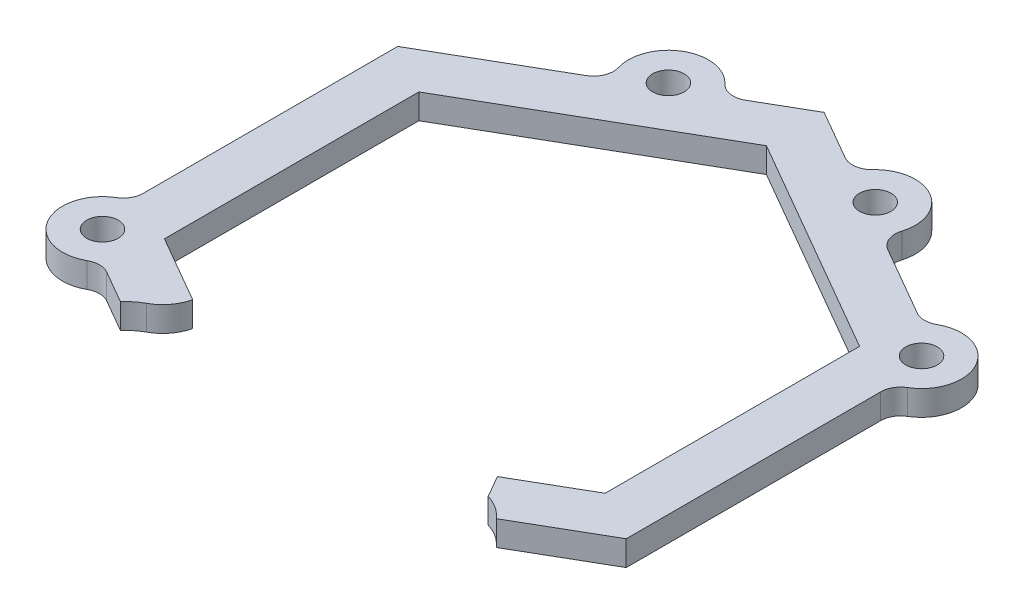
from build123d import *

# Parameters (mm, degrees)
SKETCH1_R            = 50.8
SKETCH1_R_2          = 48.8
SKETCH1_R_3          = 1.905
BOSS_EXTRUDE1_DEPTH  = 3.175
SKETCH3_R            = 50.8
SKETCH3_R_2          = 48.8
BOSS_EXTRUDE3_DEPTH  = 17.78
CUT_EXTRUDE1_DEPTH   = 75.009515604
FILLET2_R            = 6.35
SKETCH5_R            = 1.905
SKETCH5_W            = 16.479
SKETCH5_H            = 6
BOSS_EXTRUDE4_DEPTH  = 1
CUT_EXTRUDE2_DEPTH   = 75.835767181
BOSS_EXTRUDE5_DEPTH  = 17.78
SKETCH10_R           = 1.5
CUT_EXTRUDE4_DEPTH   = 75.009515742
BOSS_EXTRUDE7_START  = 17.78
SKETCH11_R           = 4.04
SKETCH11_R_2         = 1.5
BOSS_EXTRUDE7_DEPTH  = 17.78
BOSS_EXTRUDE8_START  = 31.75
BOSS_EXTRUDE8_DEPTH  = 31.75
FILLET4_R            = 3.175
BOSS_EXTRUDE9_DEPTH  = 15.24
CUT_EXTRUDE5_REACH   = 128.859
CIRPATTERN1_COUNT    = 4
BOSS_EXTRUDE12_DEPTH = 16.51
FILLET8_START        = -18
FILLET8_DEPTH        = 18
FILLET8_START_2      = -16.51
FILLET8_2_DEPTH      = 16.51
BOSS_EXTRUDE13_DEPTH = 1.5
FILLET9_R            = 5.08
BOSS_EXTRUDE14_START = -18.01
BOSS_EXTRUDE14_DEPTH = 18.01
SKETCH21_R           = 1.5
SKETCH21_R_2         = 1.905
BOSS_EXTRUDE15_DEPTH = 3.175
SKETCH22_R           = 73.302422264
CUT_EXTRUDE6_DEPTH   = 38.965
SKETCH24_R           = 2
CUT_EXTRUDE7_DEPTH   = 3.175
BOSS_EXTRUDE16_DEPTH = 3.175
FILLET10_R           = 2.54


with BuildPart() as part:
    # Sketch1 → Boss-Extrude1 (new body)
    # profile 1 of 2: a face of its own
    with BuildSketch(Plane(origin=(0, 0, 0), x_dir=(1, 0, 0), z_dir=(0, 1, 0))):
        with Locations(Location((0, 0, 0), (0, 0, 270))):
            Circle(SKETCH1_R)
        Circle(SKETCH1_R_2, mode=Mode.SUBTRACT)
    # profile 2 of 2: a face of its own
    with BuildSketch(Plane(origin=(0, 0, 0), x_dir=(1, 0, 0), z_dir=(0, 1, 0))):
        Circle(SKETCH1_R_2)
        with Locations(Location((-13.1445, 33.02, 0), (0, 0, 270))):
            Circle(SKETCH1_R_3, mode=Mode.SUBTRACT)
        with Locations(Location((13.1445, 33.02, 0), (0, 0, 270))):
            Circle(SKETCH1_R_3, mode=Mode.SUBTRACT)
    extrude(amount=BOSS_EXTRUDE1_DEPTH)

    # Sketch3 → Boss-Extrude3 (add)
    with BuildSketch(Plane(origin=(0, 3.175, 0), x_dir=(1, 0, 0), z_dir=(0, 1, 0))):
        with Locations(Location((0, 0, 0), (0, 0, 270))):
            Circle(SKETCH3_R)
        with Locations(Location((0, 0, 0), (0, 0, 270))):
            Circle(SKETCH3_R_2, mode=Mode.SUBTRACT)
    extrude(amount=BOSS_EXTRUDE3_DEPTH)

    # Sketch4 → Cut-Extrude1 (cut, through all)
    with BuildSketch(Plane(origin=(0, 3.175, 0), x_dir=(1, 0, 0), z_dir=(0, 1, 0))):
        with BuildLine():
            Line((25.4, -38.01523905), (25.4, -20.834346642))
            add(Edge.make_bspline(
                [(-25.4, -20.834346642), (0, -32.254229315), (25.4, -20.834346642)],
                knots=[0, 0, 0, 1, 1, 1], degree=2))
            Line((-25.4, -20.834346642), (-25.4, -38.01523905))
            ThreePointArc((-25.4, -38.01523905), (0, -45.72), (25.4, -38.01523905))
        make_face()
    extrude(amount=-CUT_EXTRUDE1_DEPTH, mode=Mode.SUBTRACT)

    # Fillet2
    fillet2_edges = [part.edges().sort_by_distance(p)[0] for p in [
        (25.4, 1.5875, 20.834346642),
        (-25.4, 1.5875, 20.834346642),
        (-25.4, 1.5875, 38.01523905),
        (25.4, 1.5875, 38.01523905),
    ]]
    fillet(fillet2_edges, radius=FILLET2_R)

    # Sketch5 → Boss-Extrude4 (add)
    # profile 1 of 8: a face of its own
    with BuildSketch(Plane(origin=(0, 3.175, 0), x_dir=(1, 0, 0), z_dir=(0, 1, 0))):
        with BuildLine():
            Line((13.1445, 37.925), (-13.1445, 37.925))
            ThreePointArc((-13.1445, 37.925), (-9.676141238, 36.488358762), (-8.2395, 33.02))
            Line((-8.2395, 33.02), (-8.2395, 28.115))
            Line((-8.2395, 28.115), (8.2395, 28.115))
            Line((8.2395, 28.115), (8.2395, 33.02))
            ThreePointArc((8.2395, 33.02), (9.676141238, 36.488358762), (13.1445, 37.925))
        make_face()
    # profile 2 of 8: a face of its own
    with BuildSketch(Plane(origin=(0, 3.175, 0), x_dir=(1, 0, 0), z_dir=(0, 1, 0))):
        with BuildLine():
            ThreePointArc((-8.2395, 33.02), (-9.676141238, 36.488358762), (-13.1445, 37.925))
            ThreePointArc((-13.1445, 37.925), (-16.612858762, 36.488358762), (-18.0495, 33.02))
            ThreePointArc((-18.0495, 33.02), (-16.612858762, 29.551641238), (-13.1445, 28.115))
            ThreePointArc((-13.1445, 28.115), (-9.676141238, 29.551641238), (-8.2395, 33.02))
        make_face()
        with Locations(Location((-13.1445, 33.02, 0), (0, 0, 270))):
            Circle(SKETCH5_R, mode=Mode.SUBTRACT)
    # profile 3 of 8: a face of its own
    with BuildSketch(Plane(origin=(0, 3.175, 0), x_dir=(1, 0, 0), z_dir=(0, 1, 0))):
        with BuildLine():
            ThreePointArc((18.0495, 33.02), (16.612858762, 36.488358762), (13.1445, 37.925))
            ThreePointArc((13.1445, 37.925), (9.676141238, 36.488358762), (8.2395, 33.02))
            ThreePointArc((8.2395, 33.02), (9.676141238, 29.551641238), (13.1445, 28.115))
            ThreePointArc((13.1445, 28.115), (16.612858762, 29.551641238), (18.0495, 33.02))
        make_face()
        with Locations(Location((13.1445, 33.02, 0), (0, 0, 270))):
            Circle(SKETCH5_R, mode=Mode.SUBTRACT)
    # profile 4 of 8: a face of its own
    with BuildSketch(Plane(origin=(0, 3.175, 0), x_dir=(1, 0, 0), z_dir=(0, 1, 0))):
        with BuildLine():
            Line((-8.2395, 28.115), (-8.2395, 33.02))
            ThreePointArc((-8.2395, 33.02), (-9.676141238, 29.551641238), (-13.1445, 28.115))
            Line((-13.1445, 28.115), (-8.2395, 28.115))
        make_face()
    # profile 5 of 8: a face of its own
    with BuildSketch(Plane(origin=(0, 3.175, 0), x_dir=(1, 0, 0), z_dir=(0, 1, 0))):
        with BuildLine():
            ThreePointArc((-13.1445, 28.115), (-16.612858762, 29.551641238), (-18.0495, 33.02))
            Line((-18.0495, 33.02), (-18.0495, -23.729829016))
            add(Edge.make_bspline(
                [(-17.200482213, -23.925830908), (-17.339134534, -23.883616376), (-17.479112922, -23.845147844), (-17.620279441, -23.81048615), (-17.762494237, -23.779683986), (-17.905615595, -23.752786017), (-18.049499996, -23.729828993)],
                knots=[0, 0, 0, 0, 0, 0, 0, 0.074218898, 0.074218898, 0.074218898, 0.074218898, 0.074218898, 0.074218898, 0.074218898], degree=6))
            add(Edge.make_bspline(
                [(-17.200482213, -23.925830908), (-12.719991107, -25.289975642), (-8.2395, -25.943438167)],
                knots=[0.16140783, 0.16140783, 0.16140783, 0.337805118, 0.337805118, 0.337805118], degree=2))
            Line((-8.2395, -25.943438167), (-8.2395, -2.461719083))
            Line((-8.2395, -2.461719083), (-8.2395, 3.538280917))
            Line((-8.2395, 3.538280917), (-8.2395, 28.115))
            Line((-8.2395, 28.115), (-13.1445, 28.115))
        make_face()
    # profile 6 of 8: a face of its own
    with BuildSketch(Plane(origin=(0, 3.175, 0), x_dir=(1, 0, 0), z_dir=(0, 1, 0))):
        with BuildLine():
            Line((18.0495, -23.729829016), (18.0495, 33.02))
            ThreePointArc((18.0495, 33.02), (16.612858762, 29.551641238), (13.1445, 28.115))
            Line((13.1445, 28.115), (8.2395, 28.115))
            Line((8.2395, 28.115), (8.2395, 3.538280917))
            Line((8.2395, 3.538280917), (8.2395, -2.461719083))
            Line((8.2395, -2.461719083), (8.2395, -25.943438167))
            add(Edge.make_bspline(
                [(8.2395, -25.943438167), (12.719991107, -25.289975642), (17.200482213, -23.925830908)],
                knots=[0.662194882, 0.662194882, 0.662194882, 0.83859217, 0.83859217, 0.83859217], degree=2))
            add(Edge.make_bspline(
                [(18.049499996, -23.729828993), (17.905615595, -23.752786017), (17.762494237, -23.779683986), (17.620279441, -23.81048615), (17.479112922, -23.845147844), (17.339134534, -23.883616376), (17.200482213, -23.925830908)],
                knots=[0.925781102, 0.925781102, 0.925781102, 0.925781102, 0.925781102, 0.925781102, 0.925781102, 1, 1, 1, 1, 1, 1, 1], degree=6))
        make_face()
    # profile 7 of 8: a face of its own
    with BuildSketch(Plane(origin=(0, 3.175, 0), x_dir=(1, 0, 0), z_dir=(0, 1, 0))):
        with BuildLine():
            ThreePointArc((13.1445, 28.115), (9.676141238, 29.551641238), (8.2395, 33.02))
            Line((8.2395, 33.02), (8.2395, 28.115))
            Line((8.2395, 28.115), (13.1445, 28.115))
        make_face()
    # profile 8 of 8: a face of its own
    with BuildSketch(Plane(origin=(0, 3.175, 0), x_dir=(1, 0, 0), z_dir=(0, 1, 0))):
        with Locations((0, 0.538280917)):
            Rectangle(SKETCH5_W, SKETCH5_H)
    extrude(amount=BOSS_EXTRUDE4_DEPTH)

    # Sketch6 → Cut-Extrude2 (cut, through all)
    with BuildSketch(Plane(origin=(0, 20.955, 0), x_dir=(1, 0, 0), z_dir=(0, 1, 0))):
        with BuildLine():
            Line((42.262039705, 24.4), (39.594681461, 22.86))
            ThreePointArc((39.594681461, 22.86), (44.162128778, 11.833206742), (45.72, 0))
            Line((45.72, 0), (48.8, 0))
            ThreePointArc((48.8, 0), (47.137180323, 12.630369401), (42.262039705, 24.4))
        make_face()
        with BuildLine():
            ThreePointArc((45.72, 0), (44.162128778, -11.833206742), (39.594681461, -22.86))
            Line((39.594681461, -22.86), (42.262039705, -24.4))
            ThreePointArc((42.262039705, -24.4), (47.137180323, -12.630369401), (48.8, 0))
            Line((48.8, 0), (45.72, 0))
        make_face()
        with BuildLine():
            ThreePointArc((48.8, 0), (47.137180323, -12.630369401), (42.262039705, -24.4))
            Line((42.262039705, -24.4), (43.994090512, -25.4))
            ThreePointArc((43.994090512, -25.4), (49.069031975, -13.148007491), (50.8, 0))
            Line((50.8, 0), (48.8, 0))
        make_face()
        with BuildLine():
            Line((43.994090512, 25.4), (42.262039705, 24.4))
            ThreePointArc((42.262039705, 24.4), (47.137180323, 12.630369401), (48.8, 0))
            Line((48.8, 0), (50.8, 0))
            ThreePointArc((50.8, 0), (49.069031975, 13.148007491), (43.994090512, 25.4))
        make_face()
    extrude(amount=-CUT_EXTRUDE2_DEPTH, mode=Mode.SUBTRACT)

    # Sketch7 → Boss-Extrude5 (add)
    with BuildSketch(Plane(origin=(0, 3.175, 0), x_dir=(1, 0, 0), z_dir=(0, 1, 0))):
        with BuildLine():
            Line((42.262039705, -24.4), (39.594681461, -22.86))
            ThreePointArc((39.594681461, -22.86), (45.72, 0), (39.594681461, 22.86))
            Line((39.594681461, 22.86), (42.262039705, 24.4))
            ThreePointArc((42.262039705, 24.4), (41.753056776, 25.261081723), (41.226531944, 26.111550392))
            Line((41.226531944, 26.111550392), (36.822993007, 23.569166002))
            ThreePointArc((36.822993007, 23.569166002), (43.72, 0), (36.822993007, -23.569166002))
            Line((36.822993007, -23.569166002), (41.226531944, -26.111550392))
            ThreePointArc((41.226531944, -26.111550392), (41.753056776, -25.261081723), (42.262039705, -24.4))
        make_face()
    extrude(amount=BOSS_EXTRUDE5_DEPTH)

    # Sketch10 → Cut-Extrude4 (cut, through all)
    with BuildSketch(Plane(origin=(0, 3.175, 0), x_dir=(1, 0, 0), z_dir=(0, 1, 0))):
        with Locations(Location((-32.995567884, -19.05, 0), (0, 0, 270))):
            Circle(SKETCH10_R)
        with Locations(Location((32.995567884, 19.05, 0), (0, 0, 270))):
            Circle(SKETCH10_R)
    extrude(amount=-CUT_EXTRUDE4_DEPTH, mode=Mode.SUBTRACT)

    # Sketch11 → Boss-Extrude7 (add)
    # profile 1 of 3: a face of its own
    with BuildSketch(Plane(origin=(0, 3.175, 0), x_dir=(1, 0, 0), z_dir=(0, 1, 0)).offset(BOSS_EXTRUDE7_START)):
        with BuildLine():
            Line((37.125332322, 23.09), (32.995567884, 23.09))
            ThreePointArc((32.995567884, 23.09), (35.85227928, 21.906711396), (37.035567884, 19.05))
            ThreePointArc((37.035567884, 19.05), (35.85227928, 16.193288604), (32.995567884, 15.01))
            Line((32.995567884, 15.01), (41.062614383, 15.01))
            ThreePointArc((41.062614383, 15.01), (39.302167275, 19.151450272), (37.125332322, 23.09))
        make_face()
    # profile 2 of 3: a face of its own
    with BuildSketch(Plane(origin=(0, 3.175, 0), x_dir=(1, 0, 0), z_dir=(0, 1, 0)).offset(BOSS_EXTRUDE7_START)):
        with Locations((32.995567884, 19.05)):
            Circle(SKETCH11_R)
        with Locations(Location((32.995567884, 19.05, 0), (0, 0, 270))):
            Circle(SKETCH11_R_2, mode=Mode.SUBTRACT)
    # profile 3 of 3: a face of its own
    with BuildSketch(Plane(origin=(0, 3.175, 0), x_dir=(1, 0, 0), z_dir=(0, 1, 0)).offset(BOSS_EXTRUDE7_START)):
        with Locations(Location((-32.995567884, -19.05, 0), (0, 0, 270))):
            Circle(SKETCH11_R)
        with Locations(Location((-32.995567884, -19.05, 0), (0, 0, 270))):
            Circle(SKETCH11_R_2, mode=Mode.SUBTRACT)
    extrude(amount=-BOSS_EXTRUDE7_DEPTH)

    # Sketch12 → Boss-Extrude8 (add)
    with BuildSketch(Plane.XZ.offset(BOSS_EXTRUDE8_START)):
        with BuildLine():
            ThreePointArc((28.584071469, 41.995128982), (29.185832393, 29.185832393), (41.995128982, 28.584071469))
            ThreePointArc((41.995128982, 28.584071469), (35.921024484, 35.921024484), (28.584071469, 41.995128982))
        make_face()
        with BuildLine():
            ThreePointArc((28.584071469, -41.995128982), (35.921024484, -35.921024484), (41.995128982, -28.584071469))
            ThreePointArc((41.995128982, -28.584071469), (29.185832393, -29.185832393), (28.584071469, -41.995128982))
        make_face()
        with BuildLine():
            ThreePointArc((-41.995128982, 28.584071469), (-29.185832393, 29.185832393), (-28.584071469, 41.995128982))
            ThreePointArc((-28.584071469, 41.995128982), (-35.921024484, 35.921024484), (-41.995128982, 28.584071469))
        make_face()
        with BuildLine():
            ThreePointArc((-41.995128982, -28.584071469), (-35.921024484, -35.921024484), (-28.584071469, -41.995128982))
            ThreePointArc((-28.584071469, -41.995128982), (-29.185832393, -29.185832393), (-41.995128982, -28.584071469))
        make_face()
    extrude(amount=-BOSS_EXTRUDE8_DEPTH)

    # Fillet4
    fillet4_edges = [part.edges().sort_by_distance(p)[0] for p in [
        (41.995128982, -15.875, 28.584071469),
        (28.584071469, -15.875, 41.995128982),
        (28.584071469, -15.875, -41.995128982),
        (41.995128982, -15.875, -28.584071469),
        (-28.584071469, -15.875, 41.995128982),
        (-41.995128982, -15.875, 28.584071469),
        (-41.995128982, -15.875, -28.584071469),
        (-28.584071469, -15.875, -41.995128982),
    ]]
    fillet(fillet4_edges, radius=FILLET4_R)

    # Sketch13 → Boss-Extrude9 (add)
    with BuildSketch(Plane.XZ.offset(31.75)):
        Polygon((35.022998872, 35.022998872), (30.532870812, 39.513126933), (26.940768363, 35.921024484), (35.921024484, 26.940768363), (39.513126933, 30.532870812), align=None)
        Polygon((26.940763662, -35.921029185), (35.921019783, -26.940773064), (39.513122232, -30.532875513), (35.022994171, -35.023003573), (30.532866111, -39.513131634), align=None)
        Polygon((-35.921033886, -26.940768363), (-26.940777765, -35.921024484), (-30.532880214, -39.513126933), (-35.023008274, -35.022998872), (-39.513136335, -30.532870812), align=None)
        Polygon((-26.940773064, 35.921029185), (-35.921029185, 26.940773064), (-39.513131634, 30.532875513), (-35.023003573, 35.023003573), (-30.532875513, 39.513131634), align=None)
    extrude(amount=BOSS_EXTRUDE9_DEPTH)

    # Sketch15 → Cut-Extrude5 (cut, up to next)
    with BuildSketch(Plane(origin=(-35.023003573, 0, 35.023003573), x_dir=(0.7071067811865472, 0, 0.7071067811865479), z_dir=(-0.7071067811865479, 0, 0.7071067811865472)), mode=Mode.PRIVATE) as cut_extrude5_sk1:
        with BuildLine():
            ThreePointArc((-1.280368799, -37.833557441), (-1.536442559, -40.650368799), (1.280368799, -40.906442559))
            Line((1.280368799, -40.906442559), (-1.280368799, -37.833557441))
        make_face()
    cut_extrude5_tool1 = extrude(cut_extrude5_sk1.sketch, amount=-CUT_EXTRUDE5_REACH, mode=Mode.PRIVATE) & part.part
    # Sketch15 → Cut-Extrude5 (cut, up to next)
    with BuildSketch(Plane(origin=(-35.023003573, 0, 35.023003573), x_dir=(0.7071067811865472, 0, 0.7071067811865479), z_dir=(-0.7071067811865479, 0, 0.7071067811865472)), mode=Mode.PRIVATE) as cut_extrude5_sk2:
        with BuildLine():
            Line((-1.280368799, -37.833557441), (1.280368799, -40.906442559))
            ThreePointArc((1.280368799, -40.906442559), (1.811178842, -40.218310792), (2, -39.37))
            ThreePointArc((2, -39.37), (0.848310792, -37.558821158), (-1.280368799, -37.833557441))
        make_face()
    cut_extrude5_tool2 = extrude(cut_extrude5_sk2.sketch, amount=-CUT_EXTRUDE5_REACH, mode=Mode.PRIVATE) & part.part
    # Sketch15 → Cut-Extrude5 (cut, up to next)
    with BuildSketch(Plane(origin=(-35.023003573, 0, 35.023003573), x_dir=(0.7071067811865472, 0, 0.7071067811865479), z_dir=(-0.7071067811865479, 0, 0.7071067811865472)), mode=Mode.PRIVATE) as cut_extrude5_sk3:
        with BuildLine():
            ThreePointArc((-1.280368799, -37.833557441), (-1.536442559, -40.650368799), (1.280368799, -40.906442559))
            Line((1.280368799, -40.906442559), (-1.280368799, -37.833557441))
        make_face()
    cut_extrude5_tool3 = extrude(cut_extrude5_sk3.sketch, amount=-CUT_EXTRUDE5_REACH, mode=Mode.PRIVATE) & part.part
    # Sketch15 → Cut-Extrude5 (cut, up to next)
    with BuildSketch(Plane(origin=(-35.023003573, 0, 35.023003573), x_dir=(0.7071067811865472, 0, 0.7071067811865479), z_dir=(-0.7071067811865479, 0, 0.7071067811865472)), mode=Mode.PRIVATE) as cut_extrude5_sk4:
        with BuildLine():
            Line((-1.280368799, -37.833557441), (1.280368799, -40.906442559))
            ThreePointArc((1.280368799, -40.906442559), (1.811178842, -40.218310792), (2, -39.37))
            ThreePointArc((2, -39.37), (0.848310792, -37.558821158), (-1.280368799, -37.833557441))
        make_face()
    cut_extrude5_tool4 = extrude(cut_extrude5_sk4.sketch, amount=-CUT_EXTRUDE5_REACH, mode=Mode.PRIVATE) & part.part
    cut_extrude5_1 = cut_extrude5_tool1.solids().sort_by_distance((-35.484098, -39.913405, 34.561909))[0]
    add(cut_extrude5_1, mode=Mode.SUBTRACT)
    cut_extrude5_2 = cut_extrude5_tool2.solids().sort_by_distance((-34.561909, -38.826595, 35.484098))[0]
    add(cut_extrude5_2, mode=Mode.SUBTRACT)
    cut_extrude5_3 = cut_extrude5_tool3.solids().sort_by_distance((-35.484098, -39.913405, 34.561909))[0]
    add(cut_extrude5_3, mode=Mode.SUBTRACT)
    cut_extrude5_4 = cut_extrude5_tool4.solids().sort_by_distance((-34.561909, -38.826595, 35.484098))[0]
    add(cut_extrude5_4, mode=Mode.SUBTRACT)
    cut_extrude5 = cut_extrude5_1 + cut_extrude5_2 + cut_extrude5_3 + cut_extrude5_4  # Cut-Extrude5 as one shape, for the pattern or mirror that repeats it

    # CirPattern1: Cut-Extrude5; each copy of Cut-Extrude5 runs up to whatever stops it at its own place
    cirpattern1_before = part.part  # the part as the pattern finds it: every copy runs up to it
    cirpattern1_cut_extrude5_long1 = extrude(cut_extrude5_sk1.sketch, amount=-CUT_EXTRUDE5_REACH, mode=Mode.PRIVATE)
    cirpattern1_cut_extrude5_long2 = extrude(cut_extrude5_sk2.sketch, amount=-CUT_EXTRUDE5_REACH, mode=Mode.PRIVATE)
    cirpattern1_cut_extrude5_long3 = extrude(cut_extrude5_sk3.sketch, amount=-CUT_EXTRUDE5_REACH, mode=Mode.PRIVATE)
    cirpattern1_cut_extrude5_long4 = extrude(cut_extrude5_sk4.sketch, amount=-CUT_EXTRUDE5_REACH, mode=Mode.PRIVATE)
    cirpattern1_cut_extrude5_tool1_1 = cirpattern1_cut_extrude5_long1.rotate(Axis((0, 3.175, 0), (0, -1, 0)), 1 * 360 / CIRPATTERN1_COUNT) & cirpattern1_before
    add(cirpattern1_cut_extrude5_tool1_1.solids().sort_by_distance((-34.561909, -39.913405, -35.484098))[0], mode=Mode.SUBTRACT)
    cirpattern1_cut_extrude5_tool2_1 = cirpattern1_cut_extrude5_long2.rotate(Axis((0, 3.175, 0), (0, -1, 0)), 1 * 360 / CIRPATTERN1_COUNT) & cirpattern1_before
    add(cirpattern1_cut_extrude5_tool2_1.solids().sort_by_distance((-35.484098, -38.826595, -34.561909))[0], mode=Mode.SUBTRACT)
    cirpattern1_cut_extrude5_tool3_1 = cirpattern1_cut_extrude5_long3.rotate(Axis((0, 3.175, 0), (0, -1, 0)), 1 * 360 / CIRPATTERN1_COUNT) & cirpattern1_before
    add(cirpattern1_cut_extrude5_tool3_1.solids().sort_by_distance((-34.561909, -39.913405, -35.484098))[0], mode=Mode.SUBTRACT)
    cirpattern1_cut_extrude5_tool4_1 = cirpattern1_cut_extrude5_long4.rotate(Axis((0, 3.175, 0), (0, -1, 0)), 1 * 360 / CIRPATTERN1_COUNT) & cirpattern1_before
    add(cirpattern1_cut_extrude5_tool4_1.solids().sort_by_distance((-35.484098, -38.826595, -34.561909))[0], mode=Mode.SUBTRACT)
    cirpattern1_cut_extrude5_tool1_2 = cirpattern1_cut_extrude5_long1.rotate(Axis((0, 3.175, 0), (0, -1, 0)), 2 * 360 / CIRPATTERN1_COUNT) & cirpattern1_before
    add(cirpattern1_cut_extrude5_tool1_2.solids().sort_by_distance((35.484098, -39.913405, -34.561909))[0], mode=Mode.SUBTRACT)
    cirpattern1_cut_extrude5_tool2_2 = cirpattern1_cut_extrude5_long2.rotate(Axis((0, 3.175, 0), (0, -1, 0)), 2 * 360 / CIRPATTERN1_COUNT) & cirpattern1_before
    add(cirpattern1_cut_extrude5_tool2_2.solids().sort_by_distance((34.561909, -38.826595, -35.484098))[0], mode=Mode.SUBTRACT)
    cirpattern1_cut_extrude5_tool3_2 = cirpattern1_cut_extrude5_long3.rotate(Axis((0, 3.175, 0), (0, -1, 0)), 2 * 360 / CIRPATTERN1_COUNT) & cirpattern1_before
    add(cirpattern1_cut_extrude5_tool3_2.solids().sort_by_distance((35.484098, -39.913405, -34.561909))[0], mode=Mode.SUBTRACT)
    cirpattern1_cut_extrude5_tool4_2 = cirpattern1_cut_extrude5_long4.rotate(Axis((0, 3.175, 0), (0, -1, 0)), 2 * 360 / CIRPATTERN1_COUNT) & cirpattern1_before
    add(cirpattern1_cut_extrude5_tool4_2.solids().sort_by_distance((34.561909, -38.826595, -35.484098))[0], mode=Mode.SUBTRACT)
    cirpattern1_cut_extrude5_tool1_3 = cirpattern1_cut_extrude5_long1.rotate(Axis((0, 3.175, 0), (0, -1, 0)), 3 * 360 / CIRPATTERN1_COUNT) & cirpattern1_before
    add(cirpattern1_cut_extrude5_tool1_3.solids().sort_by_distance((34.561909, -39.913405, 35.484098))[0], mode=Mode.SUBTRACT)
    cirpattern1_cut_extrude5_tool2_3 = cirpattern1_cut_extrude5_long2.rotate(Axis((0, 3.175, 0), (0, -1, 0)), 3 * 360 / CIRPATTERN1_COUNT) & cirpattern1_before
    add(cirpattern1_cut_extrude5_tool2_3.solids().sort_by_distance((35.484098, -38.826595, 34.561909))[0], mode=Mode.SUBTRACT)
    cirpattern1_cut_extrude5_tool3_3 = cirpattern1_cut_extrude5_long3.rotate(Axis((0, 3.175, 0), (0, -1, 0)), 3 * 360 / CIRPATTERN1_COUNT) & cirpattern1_before
    add(cirpattern1_cut_extrude5_tool3_3.solids().sort_by_distance((34.561909, -39.913405, 35.484098))[0], mode=Mode.SUBTRACT)
    cirpattern1_cut_extrude5_tool4_3 = cirpattern1_cut_extrude5_long4.rotate(Axis((0, 3.175, 0), (0, -1, 0)), 3 * 360 / CIRPATTERN1_COUNT) & cirpattern1_before
    add(cirpattern1_cut_extrude5_tool4_3.solids().sort_by_distance((35.484098, -38.826595, 34.561909))[0], mode=Mode.SUBTRACT)

    # Sketch17 → Boss-Extrude12 (add)
    with BuildSketch(Plane.XZ):
        with BuildLine():
            add(Edge.make_bspline(
                [(-20.908385644, 23.92853792), (-21.252685586, 24.033914158), (-21.590074219, 24.162797085), (-21.918441414, 24.314613049), (-22.235799029, 24.488530911), (-22.540264994, 24.683499874), (-23.022979339, 25.041122982), (-23.209393805, 25.192784203), (-23.388812385, 25.35281665), (-23.560757013, 25.520801391), (-23.724786032, 25.69628198), (-23.880494201, 25.878764454)],
                knots=[0.318286262, 0.318286262, 0.318286262, 0.318286262, 0.318286262, 0.318286262, 0.318286262, 0.49999907, 0.49999907, 0.49999907, 0.49999907, 0.49999907, 0.620942534, 0.620942534, 0.620942534, 0.620942534, 0.620942534, 0.620942534, 0.620942534], degree=6))
            Line((-23.880494201, 25.878764454), (-33.118995485, 20.544913251))
            ThreePointArc((-33.118995485, 20.544913251), (-31.979482603, 20.153435862), (-31.495567884, 19.05))
            ThreePointArc((-31.495567884, 19.05), (-32.667330149, 17.586353872), (-34.351914536, 18.409434812))
            Line((-34.351914536, 18.409434812), (-34.351914536, -19.833087105))
            Line((-34.351914536, -19.833087105), (-14.226813668, -31.452319508))
            ThreePointArc((-14.226813668, -31.452319508), (-12.259283229, -31.333163829), (-11.2395, -33.02))
            ThreePointArc((-11.2395, -33.02), (-11.241048638, -33.096797874), (-11.245692035, -33.173470886))
            Line((-11.245692035, -33.173470886), (0, -39.666174209))
            Line((0, -39.666174209), (11.245692035, -33.173470886))
            ThreePointArc((11.245692035, -33.173470886), (12.192, -31.370221606), (14.226813668, -31.452319508))
            Line((14.226813668, -31.452319508), (33.118995485, -20.544913251))
            ThreePointArc((33.118995485, -20.544913251), (31.696529779, -18.3), (34.351914536, -18.409434812))
            Line((34.351914536, -18.409434812), (34.351914536, 19.833087105))
            Line((34.351914536, 19.833087105), (23.880494201, 25.878764454))
            add(Edge.make_bspline(
                [(23.880494201, 25.878764454), (23.724786032, 25.69628198), (23.560757013, 25.520801391), (23.388812385, 25.35281665), (23.209393805, 25.192784203), (23.022979339, 25.041122982), (22.540264994, 24.683499874), (22.235799029, 24.488530911), (21.918441414, 24.314613049), (21.590074219, 24.162797085), (21.252685586, 24.033914158), (20.908385644, 23.92853792)],
                knots=[0.379057466, 0.379057466, 0.379057466, 0.379057466, 0.379057466, 0.379057466, 0.379057466, 0.50000093, 0.50000093, 0.50000093, 0.50000093, 0.50000093, 0.681713738, 0.681713738, 0.681713738, 0.681713738, 0.681713738, 0.681713738, 0.681713738], degree=6))
            Line((20.908385644, 23.92853792), (31.176914536, 18))
            Line((31.176914536, 18), (31.176914536, -18))
            Line((31.176914536, -18), (0, -36))
            Line((0, -36), (-31.176914536, -18))
            Line((-31.176914536, -18), (-31.176914536, 18))
            Line((-31.176914536, 18), (-20.908385644, 23.92853792))
        make_face()
        with BuildLine():
            add(Edge.make_bspline(
                [(-17.200482213, 23.925830908), (-17.459469608, 23.846978773), (-17.723083673, 23.781196488), (-17.990425461, 23.728880551), (-18.260572685, 23.690328284), (-18.532581005, 23.665740503), (-19.00632449, 23.64748488), (-19.20765189, 23.647366474), (-19.40908444, 23.654911047), (-19.610239409, 23.670133105), (-19.810734433, 23.693019578), (-20.155249132, 23.745719833), (-20.29976023, 23.77194264), (-20.443574195, 23.802182667), (-20.58654585, 23.83641693), (-20.728531441, 23.874615043), (-20.875894192, 23.918684735), (-20.882397342, 23.920638634), (-20.888898077, 23.922600907), (-20.895396381, 23.924571547), (-20.901892242, 23.926550553), (-20.908385644, 23.92853792)],
                knots=[0, 0, 0, 0, 0, 0, 0, 0.138632797, 0.138632797, 0.138632797, 0.138632797, 0.138632797, 0.240657178, 0.240657178, 0.240657178, 0.240657178, 0.240657178, 0.314859209, 0.314859209, 0.314859209, 0.314859209, 0.314859209, 0.318286262, 0.318286262, 0.318286262, 0.318286262, 0.318286262, 0.318286262, 0.318286262], degree=6))
            Line((-20.908385644, 23.92853792), (-31.176914536, 18))
            Line((-31.176914536, 18), (-31.176914536, -18))
            Line((-31.176914536, -18), (0, -36))
            Line((0, -36), (31.176914536, -18))
            Line((31.176914536, -18), (31.176914536, 18))
            Line((31.176914536, 18), (20.908385644, 23.92853792))
            add(Edge.make_bspline(
                [(20.908385644, 23.92853792), (20.901892242, 23.926550553), (20.895396381, 23.924571547), (20.888898077, 23.922600907), (20.882397342, 23.920638634), (20.875894192, 23.918684735), (20.728531441, 23.874615043), (20.58654585, 23.83641693), (20.443574195, 23.802182667), (20.29976023, 23.77194264), (20.155249132, 23.745719833), (19.810734433, 23.693019578), (19.610239409, 23.670133105), (19.40908444, 23.654911047), (19.20765189, 23.647366474), (19.00632449, 23.64748488), (18.532581005, 23.665740503), (18.260572685, 23.690328284), (17.990425461, 23.728880551), (17.723083673, 23.781196488), (17.459469608, 23.846978773), (17.200482213, 23.925830908)],
                knots=[0.681713738, 0.681713738, 0.681713738, 0.681713738, 0.681713738, 0.681713738, 0.681713738, 0.685140791, 0.685140791, 0.685140791, 0.685140791, 0.685140791, 0.759342822, 0.759342822, 0.759342822, 0.759342822, 0.759342822, 0.861367203, 0.861367203, 0.861367203, 0.861367203, 0.861367203, 1, 1, 1, 1, 1, 1, 1], degree=6))
            add(Edge.make_bspline(
                [(17.200482211, 23.925830899), (17.144714317, 23.942810174), (17.08892802, 23.959728991), (17.03312338, 23.97658725), (16.977300457, 23.993384851), (16.92145931, 24.010121695), (14.159965962, 24.834525535), (11.411116029, 25.499660319), (8.627008592, 26.010516368), (5.817329363, 26.357677075), (2.993713037, 26.535534726), (0.170010835, 26.544032169)],
                knots=[0.167149631, 0.167149631, 0.167149631, 0.167149631, 0.167149631, 0.167149631, 0.167149631, 0.173816956, 0.173816956, 0.173816956, 0.173816956, 0.173816956, 0.496759352, 0.496759352, 0.496759352, 0.496759352, 0.496759352, 0.496759352, 0.496759352], degree=6))
            Line((0.170010835, 26.544032169), (-2.385708701, 22.319852499))
            add(Edge.make_bspline(
                [(1.620176348, 5.69433156), (1.509326153, 5.687881832), (-1.385391089, 5.53059626), (-5.611900633, 5.801343952), (-7.868551057, 6.347108354), (-8.955239032, 6.817181438), (-9.386496565, 7.143658554), (-9.437257428, 7.221736919), (-9.473831725, 7.283189394), (-9.560278482, 7.765593639), (-9.482042175, 8.88761919), (-8.935485792, 11.068929454), (-7.229003309, 14.855816655), (-4.379692923, 19.560468803), (-2.385708701, 22.319852499)],
                knots=[0.090051127, 0.090051127, 0.090051127, 0.09375, 0.1875, 0.28125, 0.34375, 0.40625, 0.46875, 0.53125, 0.59375, 0.65625, 0.71875, 0.8125, 0.90625, 1, 1, 1], degree=2))
            ThreePointArc((1.620176348, 5.69433156), (11.475358731, 8.358328841), (17.337085464, 0))
            ThreePointArc((17.337085464, 0), (12.304081548, -8.009724166), (2.903861345, -6.950163046))
            add(Edge.make_bspline(
                [(2.903861345, -6.950163046), (2.496424378, -6.977033131), (-1.281397682, -7.18582742), (-7.225551643, -6.849649329), (-11.650718957, -5.820633983), (-14.952826408, -4.460745526), (-17.953705537, -2.387123362), (-20.378422572, 0.505035294), (-21.860667408, 3.983957581), (-22.33638102, 7.612065838), (-22.020118931, 11.17069053), (-20.877728865, 15.552865246), (-18.404993389, 20.924969938), (-16.555707216, 23.971622428), (-16.445662414, 24.150603211)],
                knots=[0.08261428, 0.08261428, 0.08261428, 0.09375, 0.1875, 0.28125, 0.34375, 0.40625, 0.46875, 0.53125, 0.59375, 0.65625, 0.71875, 0.8125, 0.90625, 0.912069887, 0.912069887, 0.912069887], degree=2))
            add(Edge.make_bspline(
                [(-16.445662414, 24.150603211), (-16.515723238, 24.130208348), (-16.585755757, 24.109717462), (-16.655759831, 24.089130753), (-16.725735322, 24.068448419), (-16.79568209, 24.047670662), (-16.92145931, 24.010121695), (-16.977300457, 23.993384851), (-17.03312338, 23.97658725), (-17.08892802, 23.959728991), (-17.144714317, 23.942810174), (-17.200482211, 23.925830899)],
                knots=[0.817837696, 0.817837696, 0.817837696, 0.817837696, 0.817837696, 0.817837696, 0.817837696, 0.826183044, 0.826183044, 0.826183044, 0.826183044, 0.826183044, 0.832850369, 0.832850369, 0.832850369, 0.832850369, 0.832850369, 0.832850369, 0.832850369], degree=6))
        make_face()
    extrude(amount=BOSS_EXTRUDE12_DEPTH)

    # Fillet8: read off the stored shape, not the designer's step
    # Fillet8 outline → Fillet8 (cut)
    with BuildSketch(Plane(origin=(0, 0, 0), x_dir=(1, 0, 0), z_dir=(0, 1, 0)).offset(FILLET8_START)):
        with BuildLine():
            add(Edge.make_bspline(
                [(-17.200482213, -23.925830908), (-16.823072312, -24.04073834), (-16.445662411, -24.150603216)],
                knots=[0.16140783, 0.16140783, 0.16140783, 0.176266488, 0.176266488, 0.176266488], degree=2))
            add(Edge.make_bspline(
                [(-19.814278915, -17.857491149), (-19.729210788, -18.048061118), (-18.404993389, -20.924969938), (-16.555707215, -23.971622431), (-16.445662411, -24.150603216)],
                knots=[0.805838628, 0.805838628, 0.805838628, 0.8125, 0.90625, 0.912069887, 0.912069887, 0.912069887], degree=2))
            ThreePointArc((-19.814278915, -17.857491149), (-19.646031314, -21.570938879), (-22.051716439, -24.40478439))
            ThreePointArc((-22.051716439, -24.40478439), (-19.67389065, -23.681237871), (-17.200482213, -23.925830908))
        make_face()
        with BuildLine():
            ThreePointArc((3.27583035, -26.449313478), (0.61618061, -25.873433503), (-1.364645069, -24.007500998))
            Line((-1.364645069, -24.007500998), (0.170010834, -26.544032168))
            add(Edge.make_bspline(
                [(0.170010834, -26.544032168), (1.722920592, -26.53935894), (3.27583035, -26.449313478)],
                knots=[0.50334667, 0.50334667, 0.50334667, 0.564484849, 0.564484849, 0.564484849], degree=2))
        make_face()
    extrude(amount=FILLET8_DEPTH, mode=Mode.SUBTRACT)

    # Fillet8 2 outline → Fillet8 2 (add)
    with BuildSketch(Plane(origin=(0, 0, 0), x_dir=(1, 0, 0), z_dir=(0, 1, 0)).offset(FILLET8_START_2)):
        with BuildLine():
            ThreePointArc((-2.502754207, -22.15754776), (-2.387809079, -22.324172025), (-2.279593451, -22.495243373))
            Line((-2.279593451, -22.495243373), (-2.385708701, -22.319852499))
            add(Edge.make_bspline(
                [(-2.502754207, -22.15754776), (-2.444478741, -22.238523325), (-2.385708701, -22.319852499)],
                knots=[0.997236843, 0.997236843, 0.997236843, 1, 1, 1], degree=2))
        make_face()
    extrude(amount=FILLET8_2_DEPTH)

    # Sketch18 → Boss-Extrude13 (add)
    with BuildSketch(Plane.XZ.offset(16.51)):
        with BuildLine():
            Line((20.908385644, 23.92853792), (31.176914536, 18))
            Line((31.176914536, 18), (31.176914536, -18))
            Line((31.176914536, -18), (0, -36))
            Line((0, -36), (-31.176914536, -18))
            Line((-31.176914536, -18), (-31.176914536, 18))
            Line((-31.176914536, 18), (-21.15091291, 23.788514738))
            ThreePointArc((-21.15091291, 23.788514738), (-21.584715967, 24.120911953), (-22.051716439, 24.40478439))
            ThreePointArc((-22.051716439, 24.40478439), (-23.034850715, 25.056481514), (-23.880494212, 25.878764448))
            Line((-23.880494212, 25.878764448), (-33.118995485, 20.544913251))
            ThreePointArc((-33.118995485, 20.544913251), (-31.696529779, 18.3), (-34.351914536, 18.409434812))
            Line((-34.351914536, 18.409434812), (-34.351914536, -19.833087105))
            Line((-34.351914536, -19.833087105), (-14.226813668, -31.452319508))
            ThreePointArc((-14.226813668, -31.452319508), (-12.192, -31.370221606), (-11.245692035, -33.173470886))
            Line((-11.245692035, -33.173470886), (0, -39.666174209))
            Line((0, -39.666174209), (11.245692035, -33.173470886))
            ThreePointArc((11.245692035, -33.173470886), (12.192, -31.370221606), (14.226813668, -31.452319508))
            Line((14.226813668, -31.452319508), (33.118995485, -20.544913251))
            ThreePointArc((33.118995485, -20.544913251), (31.696529779, -18.3), (34.351914536, -18.409434812))
            Line((34.351914536, -18.409434812), (34.351914536, 19.833087105))
            Line((34.351914536, 19.833087105), (23.880494212, 25.878764448))
            ThreePointArc((23.880494212, 25.878764448), (22.533694061, 24.691430503), (20.908385644, 23.92853792))
        make_face()
    extrude(amount=BOSS_EXTRUDE13_DEPTH)

    # Fillet9
    fillet9_edges = [part.edges().sort_by_distance(p)[0] for p in [
        (2.903861345, -8.255, -6.950163046),
        (1.620176348, -8.255, 5.69433156),
    ]]
    fillet(fillet9_edges, radius=FILLET9_R)

    # Sketch20 → Boss-Extrude14 (add)
    with BuildSketch(Plane.XZ.offset(18.01).offset(BOSS_EXTRUDE14_START)):
        with BuildLine():
            ThreePointArc((-30.879507358, 21.837882324), (-36.026656797, 20.8), (-34.351914536, 15.823496667))
            Line((-34.351914536, 15.823496667), (-34.351914536, 18.409434812))
            ThreePointArc((-34.351914536, 18.409434812), (-34.29460599, 19.8), (-33.118995485, 20.544913251))
            Line((-33.118995485, 20.544913251), (-30.879507358, 21.837882324))
        make_face()
        with BuildLine():
            Line((-14.226813668, -31.452319508), (-16.043331857, -30.403552243))
            ThreePointArc((-16.043331857, -30.403552243), (-15.097, -36.401829202), (-9.429173846, -34.222238151))
            Line((-9.429173846, -34.222238151), (-11.245692035, -33.173470886))
            ThreePointArc((-11.245692035, -33.173470886), (-14.097, -34.669778394), (-14.226813668, -31.452319508))
        make_face()
        with BuildLine():
            Line((11.245692035, -33.173470886), (9.429173846, -34.222238151))
            ThreePointArc((9.429173846, -34.222238151), (15.097, -36.401829202), (16.043331857, -30.403552243))
            Line((16.043331857, -30.403552243), (14.226813668, -31.452319508))
            ThreePointArc((14.226813668, -31.452319508), (14.097, -34.669778394), (11.245692035, -33.173470886))
        make_face()
        with BuildLine():
            Line((33.118995485, -20.544913251), (30.879507358, -21.837882324))
            ThreePointArc((30.879507358, -21.837882324), (36.026656797, -20.8), (34.351914536, -15.823496667))
            Line((34.351914536, -15.823496667), (34.351914536, -18.409434812))
            ThreePointArc((34.351914536, -18.409434812), (34.29460599, -19.8), (33.118995485, -20.544913251))
        make_face()
    extrude(amount=BOSS_EXTRUDE14_DEPTH)

    # Sketch21 → Boss-Extrude15 (add)
    with BuildSketch(Plane.XZ.offset(18.01)):
        with BuildLine():
            ThreePointArc((-19.503828958, 21.073284891), (-20.417909733, 23.014253156), (-22.051716439, 24.40478439))
            ThreePointArc((-22.051716439, 24.40478439), (-23.034850715, 25.056481514), (-23.880494212, 25.878764448))
            Line((-23.880494212, 25.878764448), (-30.879507358, 21.837882324))
            ThreePointArc((-30.879507358, 21.837882324), (-36.026656797, 20.8), (-34.351914536, 15.823496667))
            Line((-34.351914536, 15.823496667), (-34.351914536, -19.833087105))
            Line((-34.351914536, -19.833087105), (-16.043331857, -30.403552243))
            ThreePointArc((-16.043331857, -30.403552243), (-15.097, -36.401829202), (-9.429173846, -34.222238151))
            Line((-9.429173846, -34.222238151), (0, -39.666174209))
            Line((0, -39.666174209), (9.429173846, -34.222238151))
            ThreePointArc((9.429173846, -34.222238151), (15.097, -36.401829202), (16.043331857, -30.403552243))
            Line((16.043331857, -30.403552243), (30.879507358, -21.837882324))
            ThreePointArc((30.879507358, -21.837882324), (36.026656797, -20.8), (34.351914536, -15.823496667))
            Line((34.351914536, -15.823496667), (34.351914536, 19.833087105))
            Line((34.351914536, 19.833087105), (23.880494212, 25.878764448))
            ThreePointArc((23.880494212, 25.878764448), (22.533694061, 24.691430503), (20.908385644, 23.92853792))
            Line((20.908385644, 23.92853792), (19.320885644, 21.178907263))
            Line((19.320885644, 21.178907263), (28.001914536, 16.166912895))
            Line((28.001914536, 16.166912895), (28.001914536, -16.166912895))
            Line((28.001914536, -16.166912895), (0, -32.333825791))
            Line((0, -32.333825791), (-28.001914536, -16.166912895))
            Line((-28.001914536, -16.166912895), (-28.001914536, 16.166912895))
            Line((-28.001914536, 16.166912895), (-19.503828958, 21.073284891))
        make_face()
        with Locations(Location((32.995567884, -19.05, 0), (0, 0, 90))):
            Circle(SKETCH21_R, mode=Mode.SUBTRACT)
        with Locations(Location((-32.995567884, 19.05, 0), (0, 0, 90))):
            Circle(SKETCH21_R, mode=Mode.SUBTRACT)
        with Locations(Location((-13.1445, -33.02, 0), (0, 0, 270))):
            Circle(SKETCH21_R_2, mode=Mode.SUBTRACT)
        with Locations(Location((13.1445, -33.02, 0), (0, 0, 270))):
            Circle(SKETCH21_R_2, mode=Mode.SUBTRACT)
    extrude(amount=BOSS_EXTRUDE15_DEPTH)

    # Sketch22 → Cut-Extrude6 (cut)
    with BuildSketch(Plane(origin=(0, 20.955, 0), x_dir=(1, 0, 0), z_dir=(0, 1, 0))):
        Circle(SKETCH22_R)
    extrude(amount=-CUT_EXTRUDE6_DEPTH, mode=Mode.SUBTRACT)


with BuildPart() as body_2:
    # of the pieces the cut leaves, the one that is kept (cut_extrude6_keep)
    add(part.part.solids().sort_by_distance((-22.051716439, -18.01, 24.40478439))[0])

    # Sketch24 → Cut-Extrude7 (cut)
    with BuildSketch(Plane.XZ.offset(21.185)):
        with Locations(Location((-32.995567884, 19.05, 0), (0, 0, 270))):
            Circle(SKETCH24_R)
        with Locations(Location((-13.1445, -33.02, 0), (0, 0, 270))):
            Circle(SKETCH24_R)
        with Locations(Location((13.1445, -33.02, 0), (0, 0, 270))):
            Circle(SKETCH24_R)
        with Locations(Location((32.995567884, -19.05, 0), (0, 0, 270))):
            Circle(SKETCH24_R)
    extrude(amount=-CUT_EXTRUDE7_DEPTH, mode=Mode.SUBTRACT)

    # Sketch25 → Boss-Extrude16 (add)
    with BuildSketch(Plane.XZ.offset(21.185)):
        with BuildLine():
            Line((-30.879507358, 21.837882324), (-29.434042775, 22.67242169))
            ThreePointArc((-29.434042775, 22.67242169), (-37.394976935, 21.59), (-34.351914536, 14.154417935))
            Line((-34.351914536, 14.154417935), (-34.351914536, 15.823496667))
            ThreePointArc((-34.351914536, 15.823496667), (-36.026656797, 20.8), (-30.879507358, 21.837882324))
        make_face()
        with BuildLine():
            Line((-16.043331857, -30.403552243), (-17.078464592, -29.80591808))
            ThreePointArc((-17.078464592, -29.80591808), (-15.6845, -37.419409051), (-8.394041111, -34.819872314))
            Line((-8.394041111, -34.819872314), (-9.429173846, -34.222238151))
            ThreePointArc((-9.429173846, -34.222238151), (-15.097, -36.401829202), (-16.043331857, -30.403552243))
        make_face()
        with BuildLine():
            Line((9.429173846, -34.222238151), (8.394041111, -34.819872314))
            ThreePointArc((8.394041111, -34.819872314), (14.059395854, -38.016935619), (18.2245, -33.02))
            ThreePointArc((18.2245, -33.02), (17.929421114, -31.313855242), (17.078464592, -29.80591808))
            Line((17.078464592, -29.80591808), (16.043331857, -30.403552243))
            ThreePointArc((16.043331857, -30.403552243), (15.097, -36.401829202), (9.429173846, -34.222238151))
        make_face()
        with BuildLine():
            Line((30.879507358, -21.837882324), (29.434042775, -22.67242169))
            ThreePointArc((29.434042775, -22.67242169), (34.959473743, -23.73502655), (38.075567884, -19.05))
            ThreePointArc((38.075567884, -19.05), (37.038873524, -15.97460092), (34.351914536, -14.154417935))
            Line((34.351914536, -14.154417935), (34.351914536, -15.823496667))
            ThreePointArc((34.351914536, -15.823496667), (36.026656797, -20.8), (30.879507358, -21.837882324))
        make_face()
    extrude(amount=-BOSS_EXTRUDE16_DEPTH)

    # Fillet10
    fillet10_edges = [body_2.edges().sort_by_distance(p)[0] for p in [
        (-17.078464592, -19.5975, -29.80591808),
        (-8.394041111, -19.5975, -34.819872314),
        (8.394041111, -19.5975, -34.819872314),
        (17.078464592, -19.5975, -29.80591808),
        (29.434042775, -19.5975, -22.67242169),
        (34.351914536, -19.5975, -14.154417935),
        (-29.434042775, -19.5975, 22.67242169),
        (-34.351914536, -19.5975, 14.154417935),
    ]]
    fillet(fillet10_edges, radius=FILLET10_R)


solid = body_2.part
